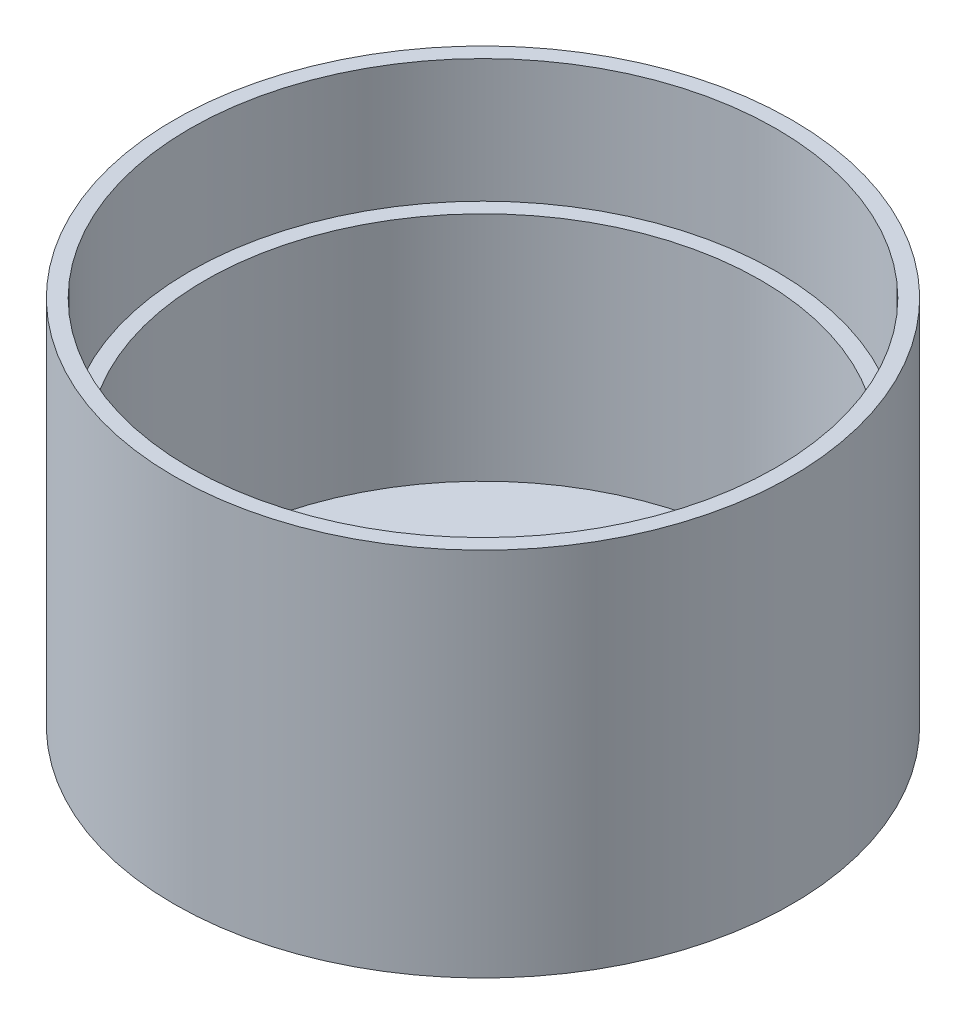
from build123d import *

# Parameters (mm, degrees)
SKETCH1_R           = 63.5
BOSS_EXTRUDE1_DEPTH = 76.2
SKETCH2_R           = 57.15
CUT_EXTRUDE1_DEPTH  = 73.025
SKETCH3_R           = 60.325
CUT_EXTRUDE2_DEPTH  = 25.4


with BuildPart() as part:
    # Sketch1 → Boss-Extrude1 (new body)
    with BuildSketch(Plane(origin=(0, 0, 0), x_dir=(1, 0, 0), z_dir=(0, 1, 0))):
        Circle(SKETCH1_R)
    extrude(amount=BOSS_EXTRUDE1_DEPTH)

    # Sketch2 → Cut-Extrude1 (cut)
    with BuildSketch(Plane(origin=(0, 76.2, 0), x_dir=(1, 0, 0), z_dir=(0, 1, 0))):
        Circle(SKETCH2_R)
    extrude(amount=-CUT_EXTRUDE1_DEPTH, mode=Mode.SUBTRACT)

    # Sketch3 → Cut-Extrude2 (cut)
    with BuildSketch(Plane(origin=(0, 76.2, 0), x_dir=(1, 0, 0), z_dir=(0, 1, 0))):
        Circle(SKETCH3_R)
    extrude(amount=-CUT_EXTRUDE2_DEPTH, mode=Mode.SUBTRACT)


solid = part.part
